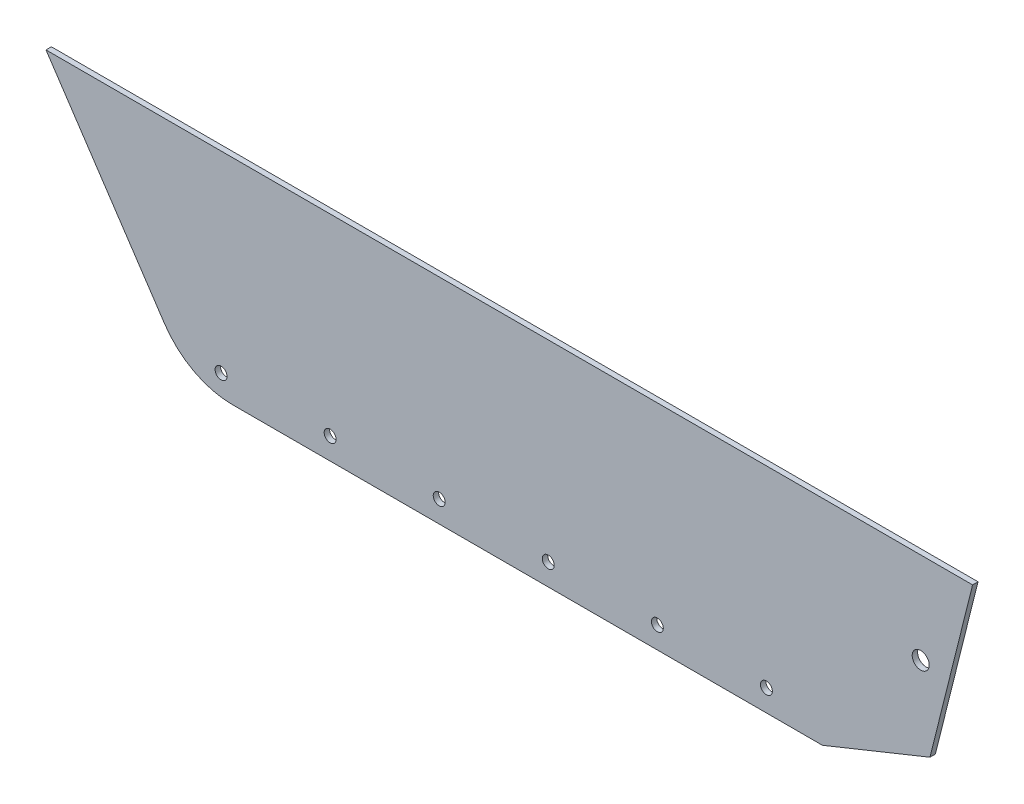
from build123d import *

# Parameters (mm, degrees)
BOSS_EXTRUDE1_DEPTH = 3.175
SKETCH1_4_R         = 3.5
CUT_EXTRUDE1_DEPTH  = 439.905857431
FILLET1_R           = 48
CUT_EXTRUDE3_DEPTH  = 10
CUT_EXTRUDE5_REACH  = 440.906
SKETCH12_R          = 5


with BuildPart() as part:
    # Sketch1 → Boss-Extrude1 (new body)
    with BuildSketch(Plane.XY):
        Polygon((-98.879411765, 3.850980392), (-31.879411765, -96.649019608), (366, -96.649019608), (403.120588235, -71.149019608), (428.120588235, 28.939617947), (-115.605170134, 28.939617947), align=None)
    extrude(amount=BOSS_EXTRUDE1_DEPTH)

    # Sketch1<4> → Cut-Extrude1 (cut, through all)
    with BuildSketch(Plane.XY):
        with Locations((-12.879411765, -83.899019608)):
            Circle(SKETCH1_4_R)
        with Locations((51.120588235, -83.899019608)):
            Circle(SKETCH1_4_R)
        with Locations((115.120588235, -83.899019608)):
            Circle(SKETCH1_4_R)
        with Locations((179.120588235, -83.899019608)):
            Circle(SKETCH1_4_R)
        with Locations((243.120588235, -83.899019608)):
            Circle(SKETCH1_4_R)
        with Locations((307.120588235, -83.899019608)):
            Circle(SKETCH1_4_R)
    extrude(amount=CUT_EXTRUDE1_DEPTH, mode=Mode.SUBTRACT)

    # Fillet1
    fillet1_edges = [part.edges().sort_by_distance(p)[0] for p in [
        (-31.879411765, -96.649019608, 1.5875),
    ]]
    fillet(fillet1_edges, radius=FILLET1_R)

    # Sketch7 → Cut-Extrude3 (cut)
    with BuildSketch(Plane.XY.offset(3.175)):
        Polygon((403.120588235, -71.149019608), (340.005873473, -96.649019608), (366, -96.649019608), align=None)
    extrude(amount=-CUT_EXTRUDE3_DEPTH, mode=Mode.SUBTRACT)

    # Sketch12 → Cut-Extrude5 (cut, up to next)
    with BuildSketch(Plane.XY.offset(3.175), mode=Mode.PRIVATE) as cut_extrude5_sk1:
        with Locations((397.677759779, -24.610405856)):
            Circle(SKETCH12_R)
    cut_extrude5_tool1 = extrude(cut_extrude5_sk1.sketch, amount=-CUT_EXTRUDE5_REACH, mode=Mode.PRIVATE) & part.part
    add(cut_extrude5_tool1.solids().sort_by_distance((397.67776, -24.610406, 3.175))[0], mode=Mode.SUBTRACT)


solid = part.part
